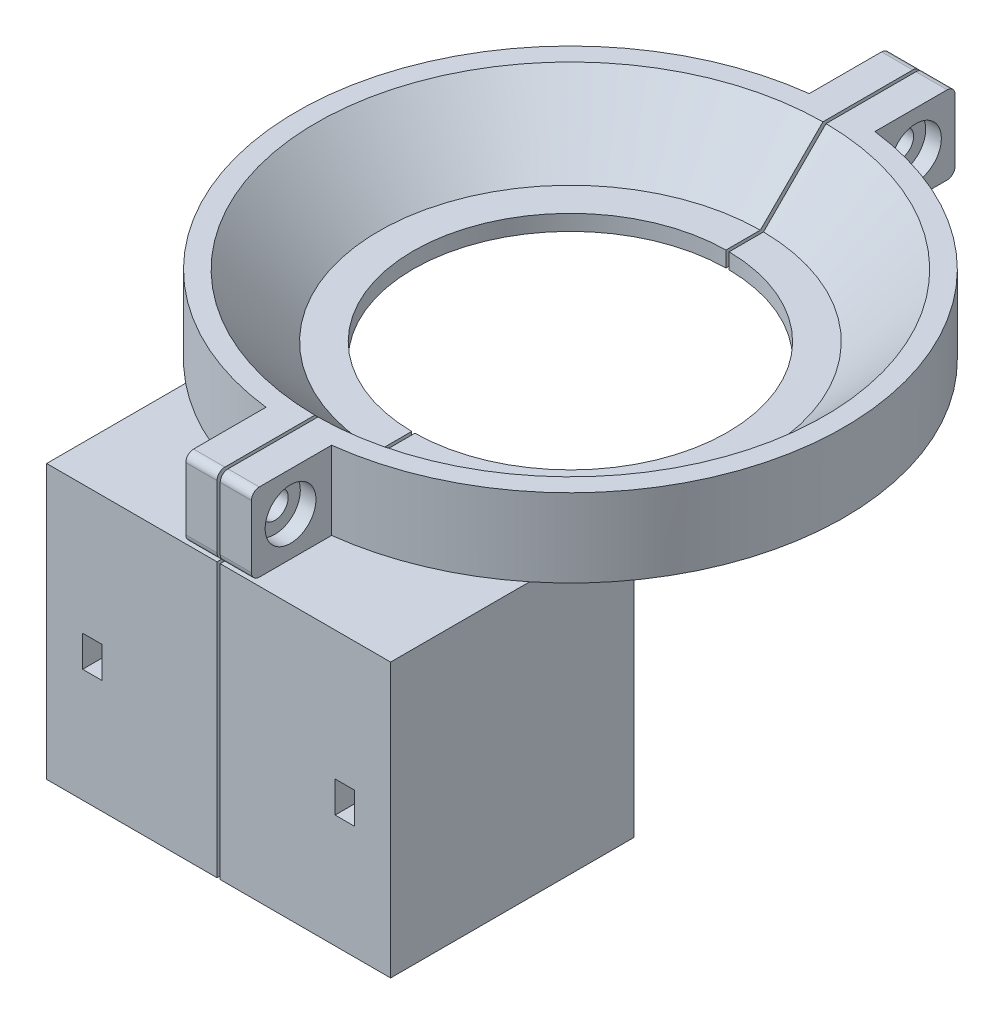
from build123d import *

# Parameters (mm, degrees)
SALIENTE_EXTRUIR1_DEPTH                     = 2
SALIENTE_EXTRUIR3_DEPTH                     = 10
CHAFL_N1_SIZE                               = 10
CROQUIS8_W                                  = 0.2
CROQUIS8_H                                  = 10
CORTAR_EXTRUIR3_DEPTH                       = 51.497524692
CROQUIS9_W                                  = 4
CROQUIS9_H                                  = 10
SALIENTE_EXTRUIR5_DEPTH                     = 10
SALIENTE_EXTRUIR5_DIRECTION_2_REACH         = 52.498
REDONDEO4_R                                 = 1
CROQUIS11_W                                 = 21.8
CROQUIS11_H                                 = 35
SALIENTE_EXTRUIR7_DEPTH                     = 10
SALIENTE_EXTRUIR8_DEPTH                     = 35
CROQUIS13_W                                 = 2.5
CROQUIS13_H                                 = 4
CORTAR_EXTRUIR4_DEPTH                       = 103.713192921
REFRENTADO_PARA_TORNILLO_CON_CABEZA_2_COUNT = 2
REFRENTADO_PARA_TORNILLO_CON_CABEZA_2_PITCH = 80
CORTAR_EXTRUIR5_DEPTH                       = 2


with BuildPart() as part:
    # Croquis1 → Saliente-Extruir1 (new body)
    with BuildSketch(Plane(origin=(0, 0, 0), x_dir=(1, 0, 0), z_dir=(0, 1, 0))):
        with BuildLine():
            Line((-22.5, 0), (-20.1, 0))
            ThreePointArc((-20.1, 0), (-14.212846302, -14.212846302), (0, -20.1))
            Line((0, -20.1), (0, -22.5))
            ThreePointArc((0, -22.5), (-15.909902577, -15.909902577), (-22.5, 0))
        make_face()
    extrude(amount=SALIENTE_EXTRUIR1_DEPTH)

    # Croquis6 → Saliente-Extruir3 (add)
    with BuildSketch(Plane(origin=(0, 0, 0), x_dir=(1, 0, 0), z_dir=(0, 1, 0))):
        with BuildLine():
            Line((-35, 0), (-22.5, 0))
            ThreePointArc((-22.5, 0), (-15.909902577, -15.909902577), (0, -22.5))
            Line((0, -22.5), (0, -35))
            ThreePointArc((0, -35), (-24.748737342, -24.748737342), (-35, 0))
        make_face()
    extrude(amount=SALIENTE_EXTRUIR3_DEPTH)

    # Chaflán1
    # the kernel refuses this chamfer: 10 mm, written as the material it takes off along each edge
    with BuildSketch(Plane(origin=(0, 10, 0), x_dir=(-0.4144760255692251, 0, -0.9100602310992054), z_dir=(0.9100602310992054, 0, -0.4144760255692251))) as chafl_n1_piece_1_section:
        Polygon((22.5, -CHAFL_N1_SIZE), (22.5 + CHAFL_N1_SIZE, 0), (22.5, 0), align=None)
    chafl_n1_piece_1 = revolve(axis=Axis((0, 10, 0), (0, 1, 0)), revolution_arc=221.027352693, mode=Mode.PRIVATE)
    chafl_n1_piece_1 = split(chafl_n1_piece_1, bisect_by=Plane(origin=(-20.16579523, 2, 20.16579523), z_dir=(0, 1, 0)), keep=Keep.TOP, mode=Mode.PRIVATE)
    add(chafl_n1_piece_1, mode=Mode.SUBTRACT)

    # Croquis8 → Cortar-Extruir3 (cut, through all)
    with BuildSketch(Plane.XY.offset(35)):
        with Locations((-0.1, 5)):
            Rectangle(CROQUIS8_W, CROQUIS8_H)
    extrude(amount=-CORTAR_EXTRUIR3_DEPTH, mode=Mode.SUBTRACT)

    # Croquis9 → Saliente-Extruir5 (add)
    with BuildSketch(Plane.XY.offset(35)):
        with Locations((-2.2, 5)):
            Rectangle(CROQUIS9_W, CROQUIS9_H)
    extrude(amount=SALIENTE_EXTRUIR5_DEPTH)

    # Croquis9 → Saliente-Extruir5 direction 2 (add, up to next)
    with BuildSketch(Plane.XY.offset(35), mode=Mode.PRIVATE) as saliente_extruir5_direction_2_sk1:
        with Locations((-2.2, 5)):
            Rectangle(CROQUIS9_W, CROQUIS9_H)
    saliente_extruir5_direction_2_tool1 = extrude(saliente_extruir5_direction_2_sk1.sketch, amount=-SALIENTE_EXTRUIR5_DIRECTION_2_REACH, mode=Mode.PRIVATE) - part.part
    add(saliente_extruir5_direction_2_tool1.solids().sort_by_distance((-2.2, 5, 35))[0])

    # Redondeo4
    redondeo4_edges = [part.edges().sort_by_distance(p)[0] for p in [
        (-2.2, 10, 45),
        (-2.2, 0, 45),
    ]]
    fillet(redondeo4_edges, radius=REDONDEO4_R)

    # Simetría30: part across plane


with BuildPart() as part_1:
    add(part.part)
    add(part.part.mirror(Plane.XY))

    # Croquis11 → Saliente-Extruir7 (add)
    with BuildSketch(Plane.XY.offset(35)):
        with Locations((-11.1, -17.5)):
            Rectangle(CROQUIS11_W, CROQUIS11_H)
    extrude(amount=SALIENTE_EXTRUIR7_DEPTH)

    # Croquis12 → Saliente-Extruir8 (add)
    with BuildSketch(Plane.XZ):
        with BuildLine():
            Line((-0.2, 35), (-0.2, 25.999230758))
            ThreePointArc((-0.2, 25.999230758), (-12.651958168, 22.714047515), (-22, 13.856406461))
            Line((-22, 13.856406461), (-22, 27.221315178))
            Line((-22, 27.221315178), (-22, 35))
            Line((-22, 35), (-0.2, 35))
        make_face()
    extrude(amount=SALIENTE_EXTRUIR8_DEPTH)

    # Croquis13 → Cortar-Extruir4 (cut, through all)
    with BuildSketch(Plane.XY.offset(45)):
        with Locations((-16.15, -18.5)):
            Rectangle(CROQUIS13_W, CROQUIS13_H)
    extrude(amount=-CORTAR_EXTRUIR4_DEPTH, mode=Mode.SUBTRACT)


with BuildPart() as body_2:
    # Simetría32: mirrored copy
    add(part_1.part.mirror(Plane(origin=(0, 0, 0), x_dir=(0, 0, 1), z_dir=(1, 0, 0))))


with BuildPart() as refrentado_para_tornillo_con_cabeza_plan_tool:
    # Croquis15 → Refrentado para tornillo con cabeza plana de M31 (revolve)
    with BuildSketch(Plane(origin=(4.2, 5, 40), x_dir=(0, 0, -1), z_dir=(0, 1, 0))):
        Polygon((0, 0), (0, 39.2), (1.7, 39.2), (1.7, 2), (3.25, 2), (3.25, 0), align=None)
    refrentado_para_tornillo_con_cabeza_plan = revolve(axis=Axis((10.55, 5, 40), (-1, 0, 0)))


with BuildPart() as part_2:
    add(part_1.part)

    # Refrentado para tornillo con cabeza plana de M31: cut by refrentado_para_tornillo_con_cabeza_plan_tool
    add(refrentado_para_tornillo_con_cabeza_plan_tool.part, mode=Mode.SUBTRACT)


with BuildPart() as body_2_1:
    add(body_2.part)

    # Refrentado para tornillo con cabeza plana de M31: cut by refrentado_para_tornillo_con_cabeza_plan_tool
    add(refrentado_para_tornillo_con_cabeza_plan_tool.part, mode=Mode.SUBTRACT)


with BuildPart() as refrentado_para_tornillo_con_cabeza_2_tool:
    # Refrentado para tornillo con cabeza  2: Refrentado para tornillo con cabeza plana de M31 ×2
    with Locations(*[(0, 0, -i * REFRENTADO_PARA_TORNILLO_CON_CABEZA_2_PITCH) for i in range(1, REFRENTADO_PARA_TORNILLO_CON_CABEZA_2_COUNT)]):
        add(refrentado_para_tornillo_con_cabeza_plan)


with BuildPart() as part_3:
    add(part_2.part)

    # Refrentado para tornillo con cabeza  2: cut by refrentado_para_tornillo_con_cabeza_2_tool
    add(refrentado_para_tornillo_con_cabeza_2_tool.part, mode=Mode.SUBTRACT)

    # Croquis17 → Cortar-Extruir5 (cut)
    with BuildSketch(Plane.ZY.offset(4.2)):
        Polygon((40, 8.406366588), (37.05, 6.703183294), (37.05, 3.296816706), (40, 1.593633412), (42.95, 3.296816706), (42.95, 6.703183294), align=None)
    cortar_extruir5 = extrude(amount=-CORTAR_EXTRUIR5_DEPTH, mode=Mode.SUBTRACT)

    # Simetría33: Cortar-Extruir5 across plane
    add(cortar_extruir5.mirror(Plane.XY), mode=Mode.SUBTRACT)


with BuildPart() as body_2_2:
    add(body_2_1.part)

    # Refrentado para tornillo con cabeza  2: cut by refrentado_para_tornillo_con_cabeza_2_tool
    add(refrentado_para_tornillo_con_cabeza_2_tool.part, mode=Mode.SUBTRACT)


solid = Compound([part_3.part, body_2_2.part])
